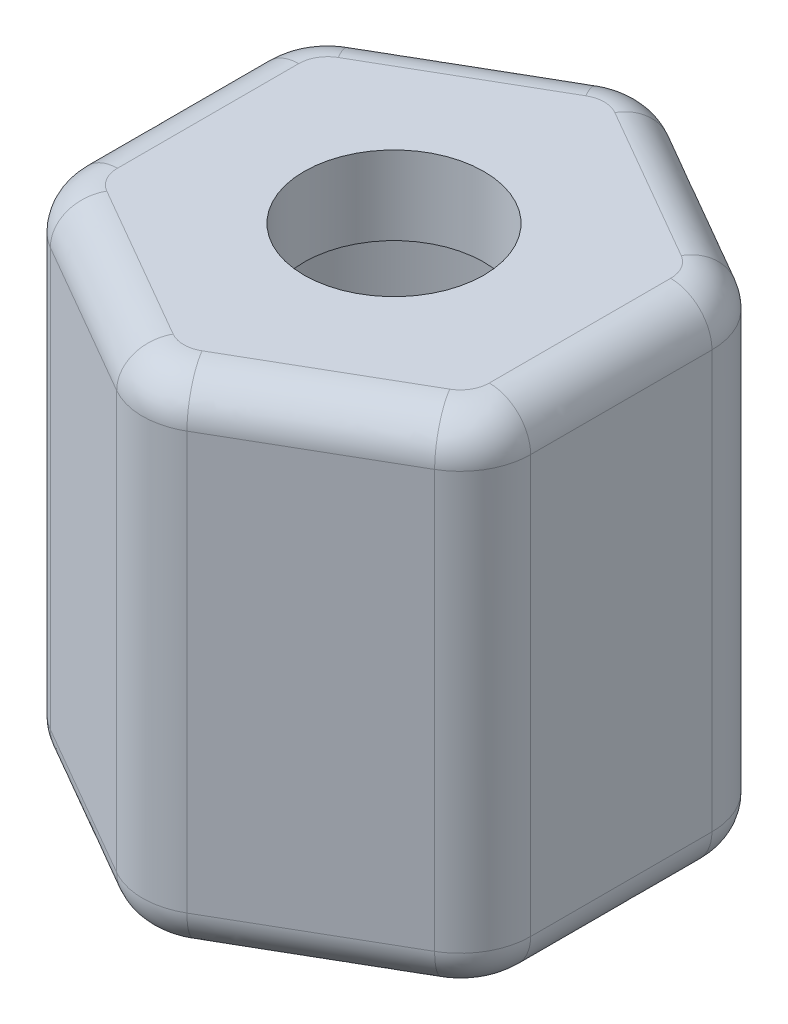
from build123d import *

# Parameters (mm, degrees)
BOSS_EXTRUDE1_DEPTH = 24.2
SKETCH3_R           = 8.85
CUT_EXTRUDE1_DEPTH  = 24.2
SKETCH4_R           = 4.35
BOSS_EXTRUDE2_DEPTH = 3.8
FILLET1_R           = 3.4
FILLET2_R           = 2
FILLET4_R           = 2


with BuildPart() as part:
    # Sketch1 → Boss-Extrude1 (new body)
    with BuildSketch(Plane(origin=(0, 0, 0), x_dir=(1, 0, 0), z_dir=(0, 1, 0))):
        Polygon((0, 12.701705922), (-11, 6.350852961), (-11, -6.350852961), (0, -12.701705922), (11, -6.350852961), (11, 6.350852961), align=None)
    extrude(amount=BOSS_EXTRUDE1_DEPTH)

    # Sketch3 → Cut-Extrude1 (cut)
    with BuildSketch(Plane(origin=(0, 24.2, 0), x_dir=(1, 0, 0), z_dir=(0, 1, 0))):
        Circle(SKETCH3_R)
    extrude(amount=-CUT_EXTRUDE1_DEPTH, mode=Mode.SUBTRACT)

    # Sketch4 → Boss-Extrude2 (add)
    with BuildSketch(Plane(origin=(0, 24.2, 0), x_dir=(1, 0, 0), z_dir=(0, 1, 0))):
        Polygon((-11, 6.350852961), (-11, -6.350852961), (0, -12.701705922), (11, -6.350852961), (11, 6.350852961), (0, 12.701705922), align=None)
        Circle(SKETCH4_R, mode=Mode.SUBTRACT)
    extrude(amount=-BOSS_EXTRUDE2_DEPTH)

    # Fillet1
    fillet1_edges = [part.edges().sort_by_distance(p)[0] for p in [
        (-11, 12.1, -6.350852961),
        (-11, 12.1, 6.350852961),
        (0, 12.1, 12.701705922),
        (11, 12.1, 6.350852961),
        (11, 12.1, -6.350852961),
        (0, 12.1, -12.701705922),
    ]]
    fillet(fillet1_edges, radius=FILLET1_R)

    # Fillet2
    fillet2_edges = [part.edges().sort_by_distance(p)[0] for p in [
        (-10.544486373, 0, -6.087862046),
        (-11, 0, 0),
        (-10.544486373, 0, 6.087862046),
        (-5.5, 0, 9.526279442),
        (0, 0, 12.175724092),
        (5.5, 0, 9.526279442),
        (10.544486373, 0, 6.087862046),
        (11, 0, 0),
        (10.544486373, 0, -6.087862046),
        (5.5, 0, -9.526279442),
        (0, 0, -12.175724092),
        (-5.5, 0, -9.526279442),
    ]]
    fillet(fillet2_edges, radius=FILLET2_R)

    # Fillet4
    fillet4_edges = [part.edges().sort_by_distance(p)[0] for p in [
        (-10.544486373, 24.2, -6.087862046),
        (-11, 24.2, 0),
        (-10.544486373, 24.2, 6.087862046),
        (-5.5, 24.2, 9.526279442),
        (0, 24.2, 12.175724092),
        (5.5, 24.2, 9.526279442),
        (10.544486373, 24.2, 6.087862046),
        (11, 24.2, 0),
        (10.544486373, 24.2, -6.087862046),
        (5.5, 24.2, -9.526279442),
        (0, 24.2, -12.175724092),
        (-5.5, 24.2, -9.526279442),
    ]]
    fillet(fillet4_edges, radius=FILLET4_R)


solid = part.part
